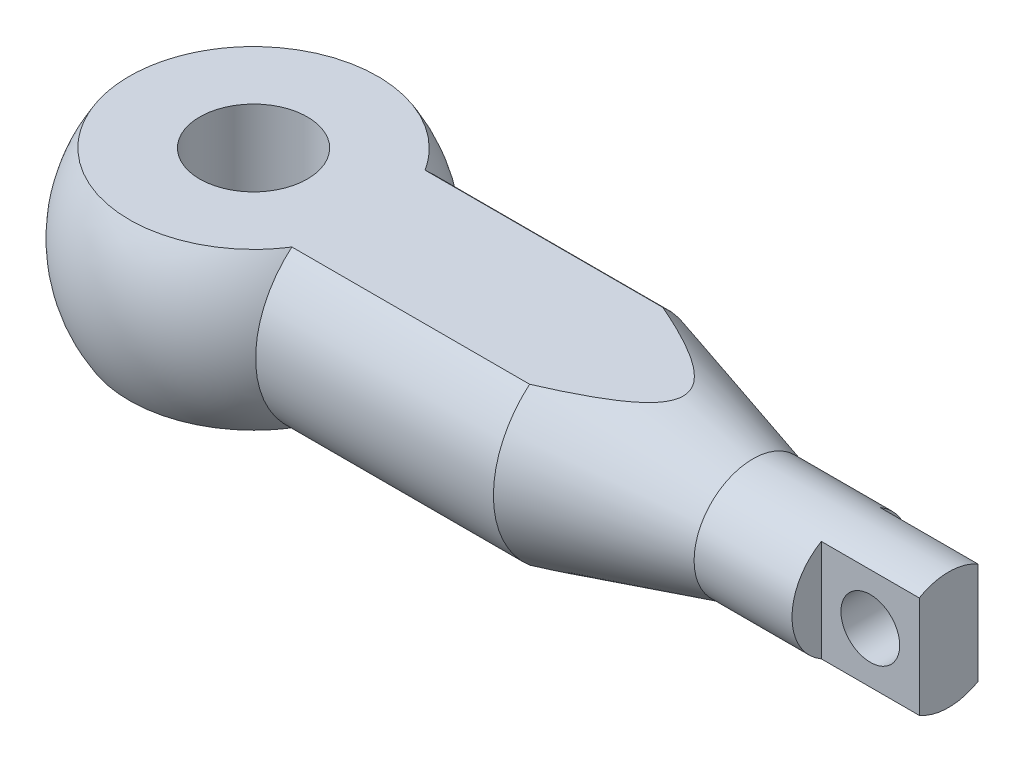
from build123d import *

# Parameters (mm, degrees)
CUT_EXTRUDE_START         = -1.5
CUT_EXTRUDE_1_OUTLINE_W   = 9
CUT_EXTRUDE_1_OUTLINE_H   = 6
CUT_EXTRUDE_1_DEPTH       = 0.7
CUT_EXTRUDE_START_2       = 0.8
CUT_EXTRUDE_1_2_OUTLINE_W = 9
CUT_EXTRUDE_1_2_OUTLINE_H = 6
CUT_EXTRUDE_1_2_DEPTH     = 0.7
CUT_EXTRUDE_2_DEPTH       = 8.431016081
CUT_EXTRUDE_2_DEPTH_BACK  = 8.431016081
SKETCH_4_R                = 0.55
CUT_EXTRUDE_3_DEPTH       = 9.766413178
CUT_EXTRUDE_3_DEPTH_BACK  = 1
SKETCH_5_OUTSIDE_W        = 6.85
SKETCH_5_OUTSIDE_H        = 5.45
SKETCH_5_OUTSIDE_W_2      = 0.6
SKETCH_5_OUTSIDE_H_2      = 3.351666402
SKETCH_7_R                = 0.3
CUT_EXTRUDE_5_DEPTH       = 8.368174808


# Read off the part's stored shape, not the designer's step: 切除-拉伸1
with BuildPart() as part:
    # 草图2 → 旋转1 (revolve)
    with BuildSketch(Plane(origin=(0, 0, 0), x_dir=(1, 0, 0), z_dir=(0, 1, 0)), mode=Mode.PRIVATE) as revolve_1_sk:
        with BuildLine():
            ThreePointArc((1.5, 0), (1.388672279, 0.567088443), (1.071214264, 1.05))
            ThreePointArc((1.071214264, 1.05), (-0.567088443, 1.388672279), (-1.5, 0))
            Line((-1.5, 0), (1.5, 0))
        make_face()
        with BuildLine():
            Line((3.5, 1.05), (1.071214264, 1.05))
            ThreePointArc((1.071214264, 1.05), (1.388672279, 0.567088443), (1.5, 0))
            Line((1.5, 0), (7.1, 0))
            Line((7.1, 0), (7.1, 0.6))
            Line((7.1, 0.6), (5.1, 0.6))
            Line((5.1, 0.6), (3.5, 1.05))
        make_face()
    revolve(revolve_1_sk.sketch.rotate(Axis((7.1, 0, 0), (1, 0, 0)), 180), axis=Axis((7.1, 0, 0), (1, 0, 0)))

    # 切除-拉伸1 outline → 切除-拉伸1 (cut)
    with BuildSketch(Plane(origin=(0, 0, 0), x_dir=(1, 0, 0), z_dir=(0, 1, 0)).offset(CUT_EXTRUDE_START)):
        with Locations((1.5, 0)):
            Rectangle(CUT_EXTRUDE_1_OUTLINE_W, CUT_EXTRUDE_1_OUTLINE_H)
    extrude(amount=CUT_EXTRUDE_1_DEPTH, mode=Mode.SUBTRACT)

    # Cut-Extrude 1 2 outline → Cut-Extrude 1 2 (cut)
    with BuildSketch(Plane(origin=(0, 0, 0), x_dir=(1, 0, 0), z_dir=(0, 1, 0)).offset(CUT_EXTRUDE_START_2)):
        with Locations((1.5, 0)):
            Rectangle(CUT_EXTRUDE_1_2_OUTLINE_W, CUT_EXTRUDE_1_2_OUTLINE_H)
    extrude(amount=CUT_EXTRUDE_1_2_DEPTH, mode=Mode.SUBTRACT)

    # 草图4 → 切除-拉伸2 (cut, two sides: drawn at the far end of the back side and taken through both)
    with BuildSketch(Plane(origin=(0, 0.8, 0), x_dir=(1, 0, 0), z_dir=(0, 1, 0)).offset(-CUT_EXTRUDE_2_DEPTH_BACK)):
        with Locations(Location((0, 0, 0), (0, 0, 270))):
            Circle(SKETCH_4_R)
    extrude(amount=CUT_EXTRUDE_2_DEPTH + CUT_EXTRUDE_2_DEPTH_BACK, mode=Mode.SUBTRACT)

    # 草图5 outside → 切除-拉伸3 (cut, two sides: drawn at the far end of the back side and taken through both)
    with BuildSketch(Plane(origin=(7.1, 0, 0), x_dir=(0, 0, -1), z_dir=(1, 0, 0)).offset(-CUT_EXTRUDE_3_DEPTH_BACK)):
        Rectangle(SKETCH_5_OUTSIDE_W, SKETCH_5_OUTSIDE_H)
        Rectangle(SKETCH_5_OUTSIDE_W_2, SKETCH_5_OUTSIDE_H_2, mode=Mode.SUBTRACT)
    extrude(amount=CUT_EXTRUDE_3_DEPTH + CUT_EXTRUDE_3_DEPTH_BACK, mode=Mode.SUBTRACT)

    # 草图7 → 切除-拉伸5 (cut, through all)
    with BuildSketch(Plane(origin=(0, 0, -0.3), x_dir=(-1, 0, 0), z_dir=(0, 0, -1))):
        with Locations((-6.6, 0)):
            Circle(SKETCH_7_R)
    extrude(amount=-CUT_EXTRUDE_5_DEPTH, mode=Mode.SUBTRACT)


solid = part.part
